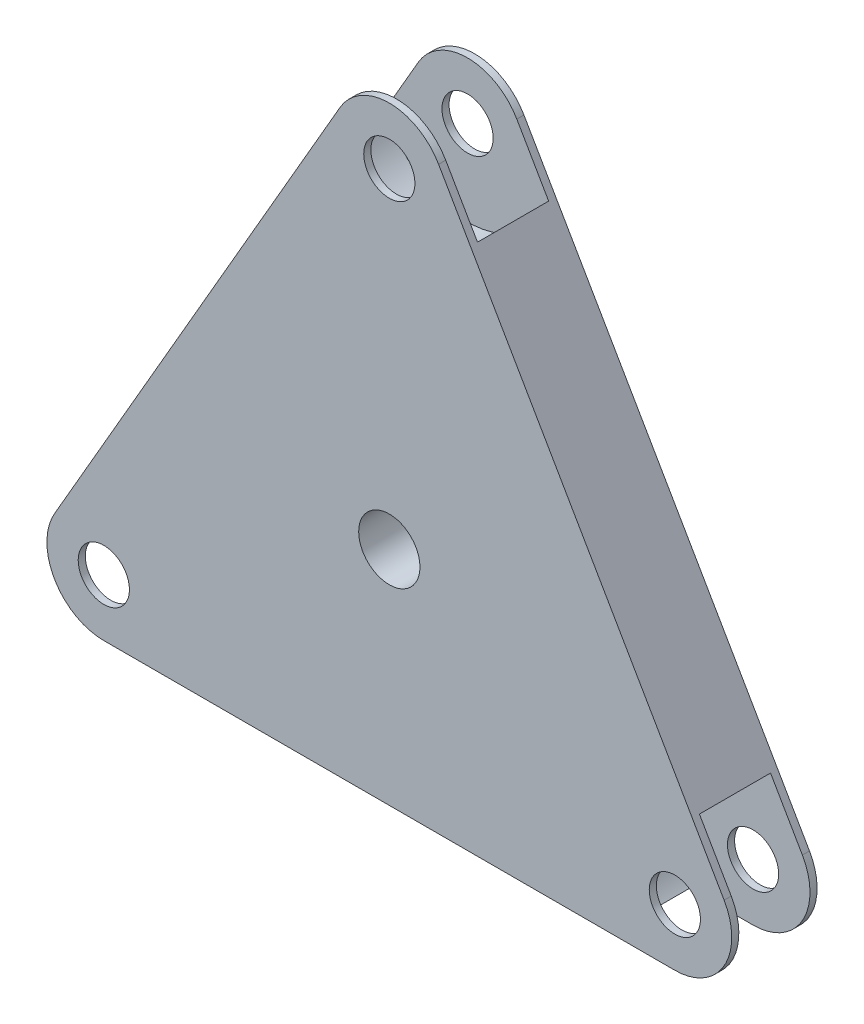
from build123d import *

# Parameters (mm, degrees)
BOSS_EXTRU_1_DEPTH           = 15
ENL_V_START                  = 7.5
ESQUISSE2_R                  = 15
ENL_V_MAT_EXTRU_1_DEPTH      = 6.25
R_P_TITION_CIRCULAIRE1_COUNT = 3
D_GAGEMENT_M81_D             = 9
ESQUISSE7_R                  = 7.460158596
ESQUISSE7_R_2                = 5.383247208
BOSS_EXTRU_2_DEPTH           = 12.5
ESQUISSE7_3_R                = 5.383247208
ENL_V_MAT_EXTRU_2_DEPTH      = 92.993073225
D_GAGEMENT_M31_D             = 3.4


with BuildPart() as part:
    # Esquisse1 → Boss.-Extru.1 (new body)
    with BuildSketch(Plane.XY):
        with BuildLine():
            Line((-8.660254038, 62.942286341), (-58.839745962, -23.97114317))
            ThreePointArc((-58.839745962, -23.97114317), (-58.839745962, -33.97114317), (-50.179491924, -38.97114317))
            Line((-50.179491924, -38.97114317), (50.179491924, -38.97114317))
            ThreePointArc((50.179491924, -38.97114317), (58.839745962, -33.97114317), (58.839745962, -23.97114317))
            Line((58.839745962, -23.97114317), (8.660254038, 62.942286341))
            ThreePointArc((8.660254038, 62.942286341), (0, 67.942286341), (-8.660254038, 62.942286341))
        make_face()
    extrude(amount=BOSS_EXTRU_1_DEPTH)

    # Esquisse2 → Enlèv. mat.-Extru.1 (cut, symmetric)
    with BuildSketch(Plane.XY.offset(ENL_V_START)):
        with Locations((0, 57.942286341)):
            Circle(ESQUISSE2_R)
    enl_v_mat_extru_1 = extrude(amount=ENL_V_MAT_EXTRU_1_DEPTH, both=True, mode=Mode.SUBTRACT)

    # Répétition circulaire1: Enlèv. mat.-Extru.1 ×3 about axis
    r_p_tition_circulaire1_axis = Axis((0, 0, -0.550606868), (0, 0, -1))
    for i in range(1, R_P_TITION_CIRCULAIRE1_COUNT):
        add(enl_v_mat_extru_1.rotate(r_p_tition_circulaire1_axis, i * 360 / R_P_TITION_CIRCULAIRE1_COUNT), mode=Mode.SUBTRACT)

    # Dégagement M81 (through all)
    with Locations(Plane(origin=(0, 0, 0), x_dir=(-1, 0, 0), z_dir=(0, 0, -1))):
        with Locations((0, 57.942286341), (50.179491924, -28.97114317), (-50.179491924, -28.97114317)):
            Hole(D_GAGEMENT_M81_D / 2)

    # Esquisse7 → Boss.-Extru.2 (add)
    with BuildSketch(Plane(origin=(0, 0, 0), x_dir=(-1, 0, 0), z_dir=(0, 0, -1))):
        Circle(ESQUISSE7_R)
        Circle(ESQUISSE7_R_2, mode=Mode.SUBTRACT)
    extrude(amount=BOSS_EXTRU_2_DEPTH)

    # Esquisse7<3> → Enlèv. mat.-Extru.2 (cut, through all)
    with BuildSketch(Plane(origin=(0, 0, 0), x_dir=(-1, 0, 0), z_dir=(0, 0, -1))):
        Circle(ESQUISSE7_3_R)
    extrude(amount=-ENL_V_MAT_EXTRU_2_DEPTH, mode=Mode.SUBTRACT)

    # Dégagement M31 (through all)
    with Locations(Plane(origin=(3.385377916, 6.647795321, -6.695872536), x_dir=(0.891106433749, -0.453794362825, 0), z_dir=(0.453794362825, 0.891106433749, 0))):
        with Locations((0, 0)):
            Hole(D_GAGEMENT_M31_D / 2)


solid = part.part
